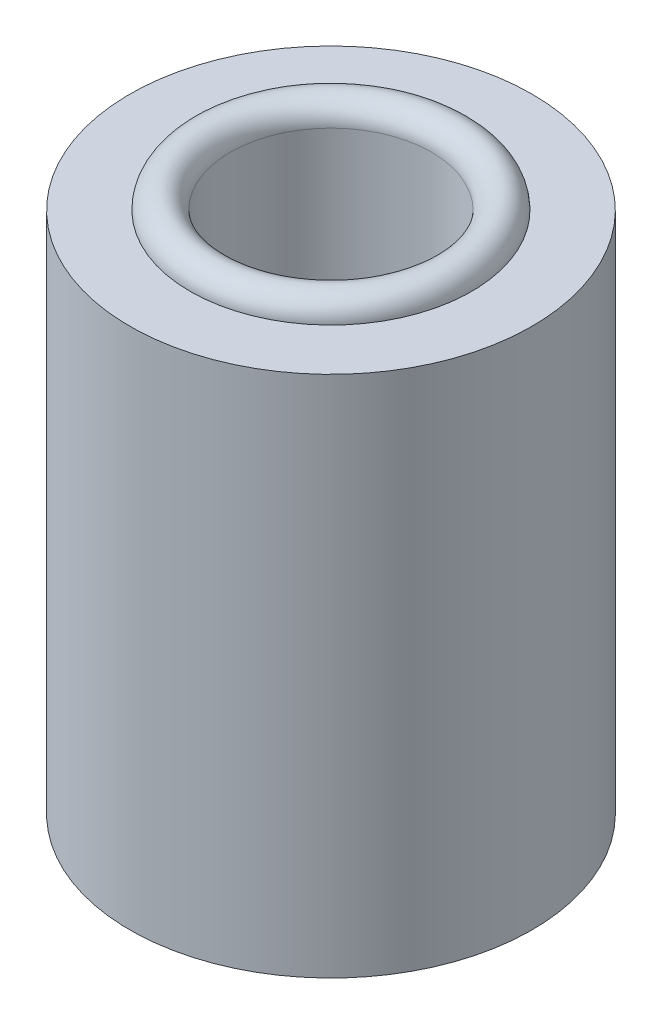
from build123d import *

# Parameters (mm, degrees)
PROFILE_SKETCH_R              = 10
PROFILE_SKETCH_R_2            = 5
CYLINDER_EXTRUDE_DEPTH        = 26
LIP_RING_SKETCH_R             = 7
LIP_RING_SKETCH_R_2           = 5
BOTTOM_LIP_RING_EXTRUDE_DEPTH = 1
BOTTOM_RING_FILLET_R          = 1
TOP_START                     = -27
SKETCH2_2_R                   = 7
SKETCH2_2_R_2                 = 5
TOP_LIP_RING_EXTRUDE_DEPTH    = 1
TOP_RING_FILLET_R             = 1


with BuildPart() as part:
    # Profile Sketch → Cylinder Extrude (new body)
    with BuildSketch(Plane(origin=(0, 0, 0), x_dir=(1, 0, 0), z_dir=(0, 1, 0))):
        with Locations(Location((0, 0, 0), (0, 0, 90))):
            Circle(PROFILE_SKETCH_R)
        with Locations(Location((0, 0, 0), (0, 0, 90))):
            Circle(PROFILE_SKETCH_R_2, mode=Mode.SUBTRACT)
    extrude(amount=CYLINDER_EXTRUDE_DEPTH)

    # Lip Ring Sketch → Bottom Lip Ring Extrude (add)
    with BuildSketch(Plane(origin=(0, 26, 0), x_dir=(1, 0, 0), z_dir=(0, 1, 0))):
        with Locations(Location((0, 0, 0), (0, 0, 270))):
            Circle(LIP_RING_SKETCH_R)
        with Locations(Location((0, 0, 0), (0, 0, 90))):
            Circle(LIP_RING_SKETCH_R_2, mode=Mode.SUBTRACT)
    extrude(amount=BOTTOM_LIP_RING_EXTRUDE_DEPTH)

    # Bottom Ring Fillet
    bottom_ring_fillet_edges = [part.edges().sort_by_distance(p)[0] for p in [
        (0, 27, -7),
        (0, 27, 5),
    ]]
    fillet(bottom_ring_fillet_edges, radius=BOTTOM_RING_FILLET_R - 0.0001)  # a hair under: the kernel refuses the full size

    # Sketch2<2> → Top Lip Ring Extrude (add)
    with BuildSketch(Plane(origin=(0, 26, 0), x_dir=(1, 0, 0), z_dir=(0, 1, 0)).offset(TOP_START)):
        with Locations(Location((0, 0, 0), (0, 0, 270))):
            Circle(SKETCH2_2_R)
        with Locations(Location((0, 0, 0), (0, 0, 90))):
            Circle(SKETCH2_2_R_2, mode=Mode.SUBTRACT)
    extrude(amount=TOP_LIP_RING_EXTRUDE_DEPTH)

    # Top Ring Fillet
    top_ring_fillet_edges = [part.edges().sort_by_distance(p)[0] for p in [
        (0, -1, -7),
        (0, -1, 5),
    ]]
    fillet(top_ring_fillet_edges, radius=TOP_RING_FILLET_R - 0.0001)  # a hair under: the kernel refuses the full size


solid = part.part
